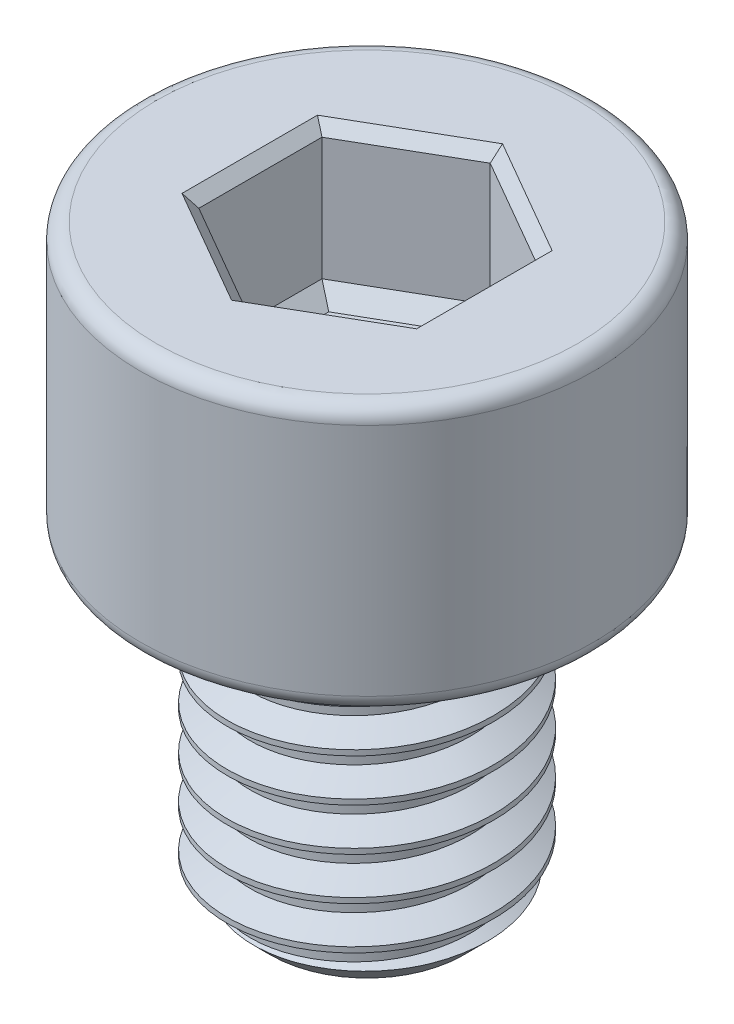
from build123d import *

# Parameters (mm, degrees)
SKETCH1_R           = 2.5
BOSS_EXTRUDE1_DEPTH = 6
THREAD1_PITCH       = 0.8
SKETCH5_R           = 4.25
BOSS_EXTRUDE2_DEPTH = 5
FILLET1_R           = 0.3
CUT_EXTRUDE1_DEPTH  = 2.5
CHAMFER1_SIZE       = 0.2
CUT_EXTRUDE2_DEPTH  = 0.3
CUT_EXTRUDE2_DRAFT  = -45


with BuildPart() as part:
    # Sketch1 → Boss-Extrude1 (new body)
    with BuildSketch(Plane(origin=(0, 0, 0), x_dir=(1, 0, 0), z_dir=(0, 1, 0))):
        with Locations(Location((0, 0, 0), (0, 0, 270))):
            Circle(SKETCH1_R)
    extrude(amount=BOSS_EXTRUDE1_DEPTH)

    # Thread1: the profile of Thread Profile1 profile screwed along a right-hand helix of 8.75 turns, 8 arcs to a turn; built about Z, then put on its axis
    thread1_z = Axis((0, 0, 0), (0, 0, 1))
    thread1_corners = [(2.5003, 0, -0.000173205), (2.5003, 0, 0.700173203), (2.0669873, 0, 0.449999999), (2.0669873, 0, 0.249999999)]
    with BuildLine(mode=Mode.PRIVATE) as thread1_profile:
        Line(thread1_corners[0], thread1_corners[1])
        Line(thread1_corners[1], thread1_corners[2])
        Line(thread1_corners[2], thread1_corners[3])
        Line(thread1_corners[3], thread1_corners[0])
    thread1_cap = Face(thread1_profile.wire())
    thread1_turn_angles = [0, 22.5, 45, 67.5, 90, 112.5, 135, 157.5, 180, 202.5, 225, 247.5, 270, 292.5, 315, 337.5, 360]
    thread1_turn_weights = [1, 0.9238795325112867, 1, 0.9238795325112867, 1, 0.9238795325112867, 1, 0.9238795325112867, 1, 0.9238795325112867, 1, 0.9238795325112867, 1, 0.9238795325112867, 1, 0.9238795325112867, 1]
    thread1_turn_rails = [Edge.make_bspline([Vector(p[0], p[1], 0).rotate(thread1_z, thread1_turn_angles[k]) / thread1_turn_weights[k] + Vector(0, 0, p[2] + THREAD1_PITCH * thread1_turn_angles[k] / 360) for k in range(17)], [0, 0, 0, 1, 1, 2, 2, 3, 3, 4, 4, 5, 5, 6, 6, 7, 7, 8, 8, 8], 2, thread1_turn_weights) for p in thread1_corners]
    thread1_turn_sides = [Face.make_surface_from_curves(thread1_turn_rails[p[0]], thread1_turn_rails[p[1]]) for p in [(0, 1), (1, 2), (2, 3), (3, 0)]]
    thread1_last_angles = [2880, 2902.5, 2925, 2947.5, 2970, 2992.5, 3015, 3037.5, 3060, 3082.5, 3105, 3127.5, 3150]
    thread1_last_weights = [1, 0.9238795325112867, 1, 0.9238795325112867, 1, 0.9238795325112867, 1, 0.9238795325112867, 1, 0.9238795325112867, 1, 0.9238795325112867, 1]
    thread1_last_rails = [Edge.make_bspline([Vector(p[0], p[1], 0).rotate(thread1_z, thread1_last_angles[k]) / thread1_last_weights[k] + Vector(0, 0, p[2] + THREAD1_PITCH * thread1_last_angles[k] / 360) for k in range(13)], [0, 0, 0, 1, 1, 2, 2, 3, 3, 4, 4, 5, 5, 6, 6, 6], 2, thread1_last_weights) for p in thread1_corners]
    thread1_last_sides = [Face.make_surface_from_curves(thread1_last_rails[p[0]], thread1_last_rails[p[1]]) for p in [(0, 1), (1, 2), (2, 3), (3, 0)]]
    thread1 = Plane(origin=(0, 7, 0), x_dir=(-1, 0, 0), z_dir=(0, -1, 0)) * Solid(Shell([*[p.moved(Location((0, 0, THREAD1_PITCH * i))) for i in range(8) for p in thread1_turn_sides], *thread1_last_sides, thread1_cap, thread1_cap.rotate(thread1_z, 3150).moved(Location((0, 0, THREAD1_PITCH * 3150 / 360)))]))
    add(thread1, mode=Mode.SUBTRACT)

    # Sketch5 → Boss-Extrude2 (add)
    with BuildSketch(Plane(origin=(0, 6, 0), x_dir=(1, 0, 0), z_dir=(0, 1, 0))):
        with Locations(Location((0, 0, 0), (0, 0, 270))):
            Circle(SKETCH5_R)
    extrude(amount=BOSS_EXTRUDE2_DEPTH)

    # Fillet1
    fillet1_edges = [part.edges().sort_by_distance(p)[0] for p in [
        (0, 6, -4.25),
        (0, 11, -4.25),
    ]]
    fillet(fillet1_edges, radius=FILLET1_R)

    # Sketch6 → Cut-Revolve1 (revolve, cut)
    with BuildSketch(Plane.XY, mode=Mode.PRIVATE) as cut_revolve1_sk:
        Polygon((2.51, 0), (2.51, 0.7), (1.81, 0), align=None)
    revolve(cut_revolve1_sk.sketch.rotate(Axis((0, 0, 0), (0, 1, 0)), 228.279472978), axis=Axis((0, 0, 0), (0, 1, 0)), mode=Mode.SUBTRACT)

    # Sketch7 → Cut-Extrude1 (cut)
    with BuildSketch(Plane(origin=(0, 11, 0), x_dir=(1, 0, 0), z_dir=(0, 1, 0))):
        Polygon((0, 2.309401077), (-2, 1.154700538), (-2, -1.154700538), (0, -2.309401077), (2, -1.154700538), (2, 1.154700538), align=None)
    extrude(amount=-CUT_EXTRUDE1_DEPTH, mode=Mode.SUBTRACT)

    # Chamfer1
    chamfer1_edges = [part.edges().sort_by_distance(p)[0] for p in [
        (1, 11, -1.732050808),
        (-1, 11, -1.732050808),
        (-2, 11, 0),
        (-1, 11, 1.732050808),
        (1, 11, 1.732050808),
        (2, 11, 0),
    ]]
    chamfer(chamfer1_edges, length=CHAMFER1_SIZE)


with BuildPart() as cut_extrude2_tool:
    # Sketch8 → Cut-Extrude2 (with draft: the straight prism first)
    with BuildSketch(Plane(origin=(0, 8.5, 0), x_dir=(1, 0, 0), z_dir=(0, 1, 0))):
        Polygon((0, 2.309401077), (-2, 1.154700538), (-2, -1.154700538), (0, -2.309401077), (2, -1.154700538), (2, 1.154700538), align=None)
    extrude(amount=-CUT_EXTRUDE2_DEPTH)
    # Cut-Extrude2: the draft: its side faces are tilted about the plane it starts from
    cut_extrude2_sides = [cut_extrude2_tool.faces().sort_by_distance(p)[0] for p in [
        (-1, 8.35, -1.732050808),
        (-2, 8.35, 0),
        (-1, 8.35, 1.732050808),
        (1, 8.35, 1.732050808),
        (2, 8.35, 0),
        (1, 8.35, -1.732050808),
    ]]
    draft(cut_extrude2_sides, Plane(origin=(0, 8.5, 0), x_dir=(1, 0, 0), z_dir=(0, 1, 0)), CUT_EXTRUDE2_DRAFT)


with BuildPart() as part_1:
    add(part.part)

    # Cut-Extrude2: cut by cut_extrude2_tool
    add(cut_extrude2_tool.part, mode=Mode.SUBTRACT)


solid = part_1.part
